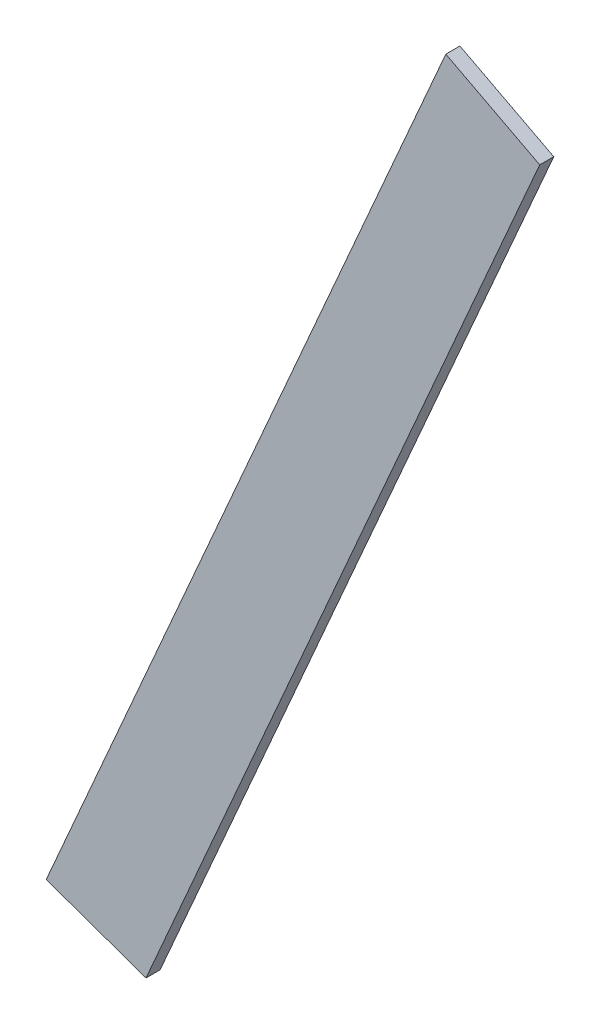
from build123d import *

# Parameters (mm, degrees)
BOSS_EXTRUDE1_DEPTH = 2


with BuildPart() as part:
    # Sketch1 → Boss-Extrude1 (new body)
    with BuildSketch(Plane.XY):
        Polygon((31.609825744, -12.278098794), (17.436860112, -7.251368663), (74.18917444, 122.641583944), (87.522241519, 115.69251982), align=None)
    extrude(amount=BOSS_EXTRUDE1_DEPTH)


solid = part.part
